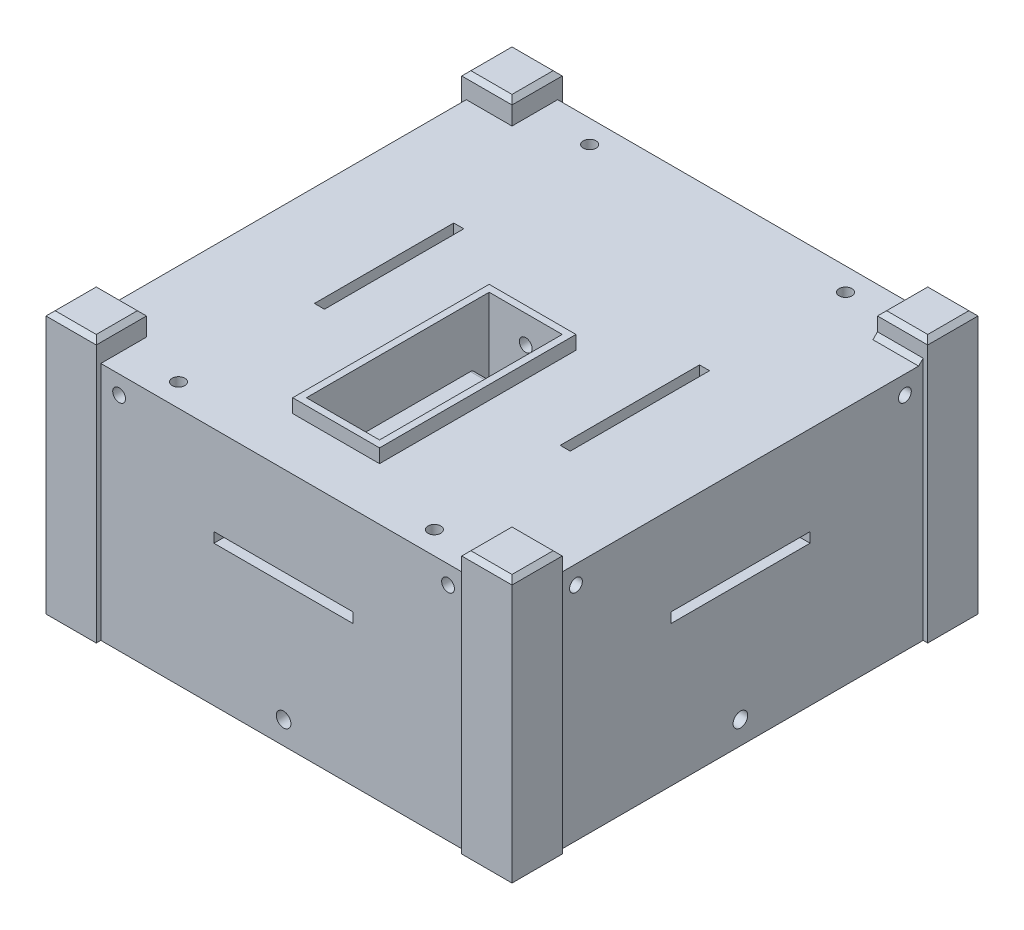
from build123d import *

# Parameters (mm, degrees)
SKETCH1_W                       = 100
SKETCH1_H                       = 100
BOSS_EXTRUDE1_DEPTH             = 95
SKETCH2_W                       = 10
SKETCH2_H                       = 10
BOSS_EXTRUDE2_DEPTH             = 105
SKETCH3_R                       = 1.4
CUT_EXTRUDE1_DEPTH              = 10
SKETCH4_W                       = 11
SKETCH4_H                       = 11
BOSS_EXTRUDE3_DEPTH             = 105
SKETCH5_R                       = 1.4
CUT_EXTRUDE2_DEPTH              = 10
SKETCH6_R                       = 1.4
CUT_EXTRUDE3_DEPTH              = 10
CHAMFER1_SIZE                   = 1
SKETCH7_W                       = 19
SKETCH7_H                       = 43
SKETCH7_W_2                     = 16
SKETCH7_H_2                     = 40
BOSS_EXTRUDE4_DEPTH             = 3
SKETCH8_W                       = 16
SKETCH8_H                       = 40
CUT_EXTRUDE4_DEPTH              = 10
CHAMFER2_SIZE                   = 13
SKETCH9_W                       = 16
SKETCH9_H                       = 3.1
CUT_EXTRUDE5_DEPTH              = 10
FILLET1_R                       = 1
SKETCH10_R                      = 1.4
CUT_EXTRUDE6_DEPTH              = 10
SKETCH11_R                      = 5
BOSS_EXTRUDE5_DEPTH             = 3
SKETCH12_W                      = 30.5
SKETCH12_H                      = 2.2
CUT_EXTRUDE7_DEPTH              = 3
SKETCH13_W                      = 30.5
SKETCH13_H                      = 2.2
CUT_EXTRUDE8_DEPTH              = 3
SKETCH14_W                      = 2.2
SKETCH14_H                      = 30.5
CUT_EXTRUDE9_DEPTH              = 3
CUT_EXTRUDE10_DEPTH             = 45
CUT_EXTRUDE10_DEPTH_BACK        = 45
SKETCH15_W                      = 90
SKETCH15_H                      = 58
CUT_EXTRUDE11_REACH             = 125.296
CUT_EXTRUDE11_DIRECTION_2_REACH = 125.296
CHAMFER3_SIZE                   = 4
SKETCH17_W                      = 102
SKETCH17_H                      = 53.035118915
CUT_EXTRUDE12_DEPTH             = 152.673992497
SKETCH19_W                      = 95
SKETCH19_H                      = 95
CUT_EXTRUDE14_DEPTH             = 12
SKETCH20_R                      = 1.6
CUT_EXTRUDE15_DEPTH             = 152.003311222
SKETCH21_R                      = 1.6
CUT_EXTRUDE16_DEPTH             = 152.003311222


with BuildPart() as part:
    # Sketch1 → Boss-Extrude1 (new body)
    with BuildSketch(Plane(origin=(0, 0, 0), x_dir=(1, 0, 0), z_dir=(0, 1, 0))):
        Rectangle(SKETCH1_W, SKETCH1_H)
    extrude(amount=BOSS_EXTRUDE1_DEPTH)

    # Sketch2 → Boss-Extrude2 (add)
    with BuildSketch(Plane(origin=(0, 100, 0), x_dir=(1, 0, 0), z_dir=(0, 1, 0))):
        with Locations((-45, 45)):
            Rectangle(SKETCH2_W, SKETCH2_H)
        with Locations((45, 45)):
            Rectangle(SKETCH2_W, SKETCH2_H)
        with Locations((45, -45)):
            Rectangle(SKETCH2_W, SKETCH2_H)
        with Locations((-45, -45)):
            Rectangle(SKETCH2_W, SKETCH2_H)
    extrude(amount=-BOSS_EXTRUDE2_DEPTH)

    # Sketch3 → Cut-Extrude1 (cut)
    with BuildSketch(Plane(origin=(0, 95, 0), x_dir=(1, 0, 0), z_dir=(0, 1, 0))):
        with Locations(Location((-28, -45, 0), (0, 0, 270))):
            Circle(SKETCH3_R)
        with Locations(Location((28, -45, 0), (0, 0, 90))):
            Circle(SKETCH3_R)
        with Locations(Location((28, 45, 0), (0, 0, 270))):
            Circle(SKETCH3_R)
        with Locations(Location((-28, 45, 0), (0, 0, 90))):
            Circle(SKETCH3_R)
    cut_extrude1 = extrude(amount=-CUT_EXTRUDE1_DEPTH, mode=Mode.SUBTRACT)

    # Sketch4 → Boss-Extrude3 (add)
    with BuildSketch(Plane(origin=(0, 100, 0), x_dir=(1, 0, 0), z_dir=(0, 1, 0))):
        with Locations((-45.5, 45.5)):
            Rectangle(SKETCH4_W, SKETCH4_H)
        with Locations((45.5, 45.5)):
            Rectangle(SKETCH4_W, SKETCH4_H)
        with Locations((45.5, -45.5)):
            Rectangle(SKETCH4_W, SKETCH4_H)
        with Locations((-45.5, -45.5)):
            Rectangle(SKETCH4_W, SKETCH4_H)
    extrude(amount=-BOSS_EXTRUDE3_DEPTH)

    # Sketch5 → Cut-Extrude2 (cut)
    with BuildSketch(Plane.XY.offset(50)):
        with Locations((-36, 91)):
            Circle(SKETCH5_R)
        with Locations(Location((36, 91, 0), (0, 0, 180))):
            Circle(SKETCH5_R)
        with Locations((36, 4)):
            Circle(SKETCH5_R)
        with Locations(Location((-36, 4, 0), (0, 0, 180))):
            Circle(SKETCH5_R)
    cut_extrude2 = extrude(amount=-CUT_EXTRUDE2_DEPTH, mode=Mode.SUBTRACT)

    # Mirror1: Cut-Extrude2 across plane
    add(cut_extrude2.mirror(Plane.XY), mode=Mode.SUBTRACT)

    # Sketch6 → Cut-Extrude3 (cut)
    with BuildSketch(Plane.ZY.offset(50)):
        with Locations((-36, 91)):
            Circle(SKETCH6_R)
        with Locations(Location((36, 91, 0), (0, 0, 180))):
            Circle(SKETCH6_R)
        with Locations((36, 4)):
            Circle(SKETCH6_R)
        with Locations(Location((-36, 4, 0), (0, 0, 180))):
            Circle(SKETCH6_R)
    cut_extrude3 = extrude(amount=-CUT_EXTRUDE3_DEPTH, mode=Mode.SUBTRACT)

    # Mirror2: Cut-Extrude3 across plane
    add(cut_extrude3.mirror(Plane(origin=(0, 0, 0), x_dir=(0, 0, 1), z_dir=(1, 0, 0))), mode=Mode.SUBTRACT)

    # Mirror3: Cut-Extrude1 across plane
    add(cut_extrude1.mirror(Plane.ZX.offset(47.5)), mode=Mode.SUBTRACT)

    # Chamfer1
    chamfer1_edges = [part.edges().sort_by_distance(p)[0] for p in [
        (-45.5, -5, 51),
        (-51, -5, 45.5),
        (-51, 100, 45.5),
        (-45.5, 100, 51),
        (51, -5, 45.5),
        (45.5, -5, 51),
        (45.5, 100, 51),
        (51, 100, 45.5),
        (45.5, -5, -51),
        (51, -5, -45.5),
        (51, 100, -45.5),
        (45.5, 100, -51),
        (-51, -5, -45.5),
        (-45.5, -5, -51),
        (-45.5, 100, -51),
        (-51, 100, -45.5),
        (-45.5, -5, 40),
        (-40, -5, 45.5),
        (-40, 100, 45.5),
        (-45.5, 100, 40),
        (40, -5, 45.5),
        (45.5, -5, 40),
        (45.5, 100, 40),
        (40, 100, 45.5),
        (45.5, -5, -40),
        (40, -5, -45.5),
        (45, 95, -40),
        (40, 100, -45.5),
        (45.5, 100, -40),
        (-40, -5, -45.5),
        (-45.5, -5, -40),
        (-45.5, 100, -40),
        (-40, 100, -45.5),
    ]]
    chamfer(chamfer1_edges, length=CHAMFER1_SIZE)

    # Sketch7 → Boss-Extrude4 (add)
    with BuildSketch(Plane(origin=(0, 95, 0), x_dir=(1, 0, 0), z_dir=(0, 1, 0))):
        with Locations((0, -17)):
            Rectangle(SKETCH7_W, SKETCH7_H)
        with Locations((0, -17)):
            Rectangle(SKETCH7_W_2, SKETCH7_H_2, mode=Mode.SUBTRACT)
    extrude(amount=BOSS_EXTRUDE4_DEPTH)

    # Sketch8 → Cut-Extrude4 (cut)
    with BuildSketch(Plane(origin=(0, 95, 0), x_dir=(1, 0, 0), z_dir=(0, 1, 0))):
        with Locations((0, -17)):
            Rectangle(SKETCH8_W, SKETCH8_H)
    extrude(amount=-CUT_EXTRUDE4_DEPTH, mode=Mode.SUBTRACT)

    # Chamfer2
    chamfer2_edges = [part.edges().sort_by_distance(p)[0] for p in [
        (0, 85, 37),
    ]]
    chamfer(chamfer2_edges, length=CHAMFER2_SIZE - 0.0001)  # a hair under: the kernel refuses the full size

    # Sketch9 → Cut-Extrude5 (cut)
    with BuildSketch(Plane(origin=(0, 85, 0), x_dir=(1, 0, 0), z_dir=(0, 1, 0))):
        with Locations((0, 1.45)):
            Rectangle(SKETCH9_W, SKETCH9_H)
    extrude(amount=-CUT_EXTRUDE5_DEPTH, mode=Mode.SUBTRACT)

    # Fillet1
    fillet1_edges = [part.edges().sort_by_distance(p)[0] for p in [
        (0, 85, 0.1),
    ]]
    fillet(fillet1_edges, radius=FILLET1_R)

    # Sketch10 → Cut-Extrude6 (cut)
    with BuildSketch(Plane.XY.offset(-3)):
        with Locations((0, 92)):
            Circle(SKETCH10_R)
    extrude(amount=-CUT_EXTRUDE6_DEPTH, mode=Mode.SUBTRACT)

    # Sketch11 → Boss-Extrude5 (add)
    with BuildSketch(Plane.XZ):
        with Locations(Location((0, -15, 0), (0, 0, 90))):
            Circle(SKETCH11_R)
    extrude(amount=BOSS_EXTRUDE5_DEPTH)

    # Sketch12 → Cut-Extrude7 (cut)
    with BuildSketch(Plane.ZY.offset(50)):
        with Locations((0, 74.4)):
            Rectangle(SKETCH12_W, SKETCH12_H)
        with Locations((0, 20.6)):
            Rectangle(SKETCH12_W, SKETCH12_H)
    cut_extrude7 = extrude(amount=-CUT_EXTRUDE7_DEPTH, mode=Mode.SUBTRACT)

    # Mirror4: Cut-Extrude7 across plane
    add(cut_extrude7.mirror(Plane(origin=(0, 0, 0), x_dir=(0, 0, 1), z_dir=(1, 0, 0))), mode=Mode.SUBTRACT)

    # Sketch13 → Cut-Extrude8 (cut)
    with BuildSketch(Plane.XY.offset(50)):
        with Locations((0, 74.4)):
            Rectangle(SKETCH13_W, SKETCH13_H)
        with Locations((0, 20.6)):
            Rectangle(SKETCH13_W, SKETCH13_H)
    cut_extrude8 = extrude(amount=-CUT_EXTRUDE8_DEPTH, mode=Mode.SUBTRACT)

    # Mirror5: Cut-Extrude8 across plane
    add(cut_extrude8.mirror(Plane.XY), mode=Mode.SUBTRACT)

    # Sketch14 → Cut-Extrude9 (cut)
    with BuildSketch(Plane(origin=(0, 95, 0), x_dir=(1, 0, 0), z_dir=(0, 1, 0))):
        with Locations((26.9, 0)):
            Rectangle(SKETCH14_W, SKETCH14_H)
        with Locations((-26.9, 0)):
            Rectangle(SKETCH14_W, SKETCH14_H)
    cut_extrude9 = extrude(amount=-CUT_EXTRUDE9_DEPTH, mode=Mode.SUBTRACT)

    # Mirror6: Cut-Extrude9 across plane
    add(cut_extrude9.mirror(Plane.ZX.offset(47.5)), mode=Mode.SUBTRACT)

    # Sketch15 → Cut-Extrude10 (cut, two sides: drawn at the far end of the back side and taken through both)
    with BuildSketch(Plane(origin=(0, 0, 0), x_dir=(0, 0, -1), z_dir=(1, 0, 0)).offset(-CUT_EXTRUDE10_DEPTH_BACK)):
        with Locations((0, 41)):
            Rectangle(SKETCH15_W, SKETCH15_H)
    extrude(amount=CUT_EXTRUDE10_DEPTH + CUT_EXTRUDE10_DEPTH_BACK, mode=Mode.SUBTRACT)

    # Cut-Extrude11: up to this face of the body (flat: up to its plane)
    cut_extrude11_end = Plane(part.part.faces().sort_by_distance((0, 41, 45))[0])
    # Sketch16 → Cut-Extrude11 (cut, up to the picked face)
    with BuildSketch(Plane.XY, mode=Mode.PRIVATE) as cut_extrude11_sk1:
        Polygon((45, 57.006357685), (-45, 57.006357685), (-45, 83), (-13, 83), (-13, 67.006357685), (13, 67.006357685), (13, 83), (45, 83), align=None)
    cut_extrude11_tool1 = split(extrude(cut_extrude11_sk1.sketch, amount=CUT_EXTRUDE11_REACH, mode=Mode.PRIVATE), bisect_by=cut_extrude11_end, keep=Keep.BOTH, mode=Mode.PRIVATE)
    add(cut_extrude11_tool1.solids().sort_by(Axis((0, 57.943143, 0), (0, 0, 1)))[0], mode=Mode.SUBTRACT)

    # Cut-Extrude11 direction 2: up to this face of the body (flat: up to its plane)
    cut_extrude11_direction_2_end = Plane(part.part.faces().sort_by_distance((0, 41, -45))[0])
    # Sketch16 → Cut-Extrude11 direction 2 (cut, up to the picked face)
    with BuildSketch(Plane.XY, mode=Mode.PRIVATE) as cut_extrude11_direction_2_sk1:
        Polygon((45, 57.006357685), (-45, 57.006357685), (-45, 83), (-13, 83), (-13, 67.006357685), (13, 67.006357685), (13, 83), (45, 83), align=None)
    cut_extrude11_direction_2_tool1 = split(extrude(cut_extrude11_direction_2_sk1.sketch, amount=-CUT_EXTRUDE11_DIRECTION_2_REACH, mode=Mode.PRIVATE), bisect_by=cut_extrude11_direction_2_end, keep=Keep.BOTH, mode=Mode.PRIVATE)
    add(cut_extrude11_direction_2_tool1.solids().sort_by(Axis((0, 57.943143, 0), (0, 0, -1)))[0], mode=Mode.SUBTRACT)

    # Chamfer3
    chamfer3_edges = [part.edges().sort_by_distance(p)[0] for p in [
        (13, 70, 0),
        (-13, 70, 0),
    ]]
    chamfer(chamfer3_edges, length=CHAMFER3_SIZE)

    # Sketch17 → Cut-Extrude12 (cut, through all)
    with BuildSketch(Plane(origin=(51, 0, 0), x_dir=(0, 0, -1), z_dir=(1, 0, 0))):
        with Locations((0, 15.982440543)):
            Rectangle(SKETCH17_W, SKETCH17_H)
    extrude(amount=-CUT_EXTRUDE12_DEPTH, mode=Mode.SUBTRACT)

    # Sketch19 → Cut-Extrude14 (cut)
    with BuildSketch(Plane.XZ.offset(-42.5)):
        Rectangle(SKETCH19_W, SKETCH19_H)
    extrude(amount=-CUT_EXTRUDE14_DEPTH, mode=Mode.SUBTRACT)

    # Sketch20 → Cut-Extrude15 (cut, through all)
    with BuildSketch(Plane(origin=(50, 0, 0), x_dir=(0, 0, -1), z_dir=(1, 0, 0))):
        with Locations((0, 47.5)):
            Circle(SKETCH20_R)
    extrude(amount=-CUT_EXTRUDE15_DEPTH, mode=Mode.SUBTRACT)

    # Sketch21 → Cut-Extrude16 (cut, through all)
    with BuildSketch(Plane(origin=(0, 0, -50), x_dir=(-1, 0, 0), z_dir=(0, 0, -1))):
        with Locations((0, 47.5)):
            Circle(SKETCH21_R)
    extrude(amount=-CUT_EXTRUDE16_DEPTH, mode=Mode.SUBTRACT)


solid = part.part
